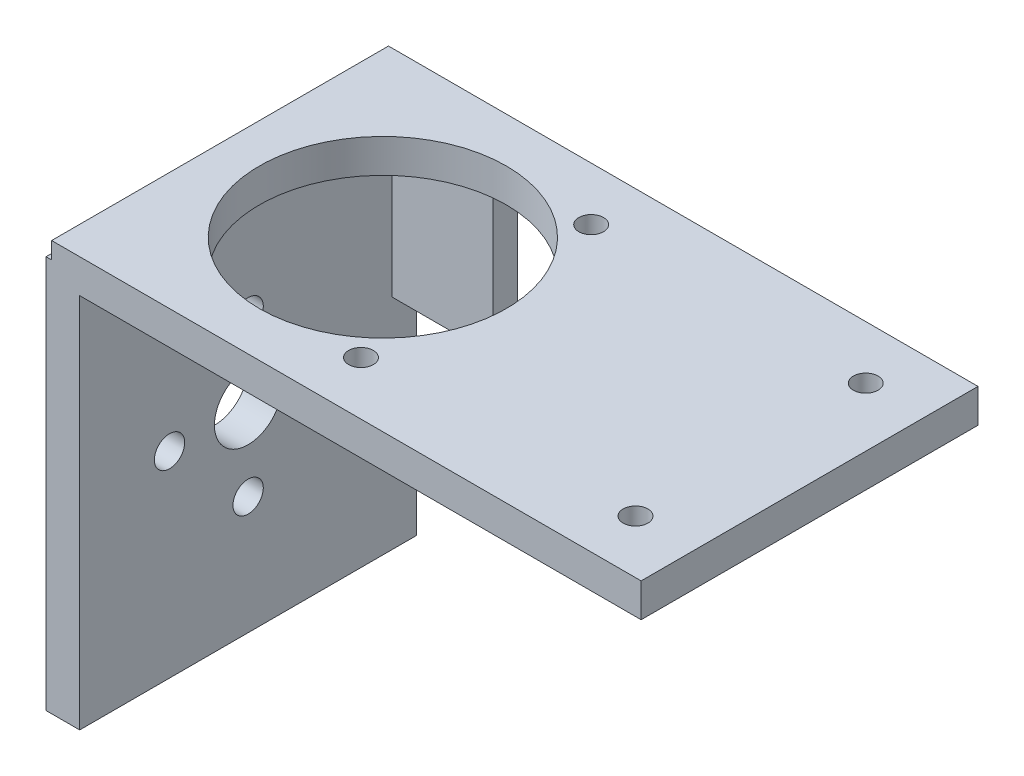
from build123d import *

# Parameters (mm, degrees)
S_BOX1_W      = 3
S_BOX1_H      = 35
BOSS_1_DEPTH  = 30
S_BOX2_W      = 52.5
S_BOX2_H      = 3
BOSS_2_DEPTH  = 30
S_BOX3_W      = 11.5
S_BOX3_H      = 16.5
BOSS_3_DEPTH  = 2.2
S_HOLE4_R     = 3
HOLE_4_DEPTH  = 3.2
S_HOLE5_R     = 1.35
HOLE_5_DEPTH  = 3.2
S_HOLE6_R     = 1.35
HOLE_6_DEPTH  = 3.2
S_HOLE7_R     = 1.35
HOLE_7_DEPTH  = 3.2
S_HOLE8_R     = 1.35
HOLE_8_DEPTH  = 3.2
S_HOLE9_R     = 11
HOLE_9_DEPTH  = 3.2
S_HOLE10_R    = 1.1
HOLE_10_DEPTH = 3.2
S_HOLE11_R    = 1.1
HOLE_11_DEPTH = 3.2
S_HOLE12_R    = 1.1
HOLE_12_DEPTH = 3.2
S_HOLE13_R    = 1.1
HOLE_13_DEPTH = 3.2


with BuildPart() as part:
    # S_box1 → Boss_1 (new body)
    with BuildSketch(Plane.XY.offset(-15)):
        with Locations((-13.5, 0)):
            Rectangle(S_BOX1_W, S_BOX1_H)
    extrude(amount=BOSS_1_DEPTH)

    # S_box2 → Boss_2 (add)
    with BuildSketch(Plane.XY.offset(-15)):
        with Locations((11.75, 17.5)):
            Rectangle(S_BOX2_W, S_BOX2_H)
    extrude(amount=BOSS_2_DEPTH)

    # S_box3 → Boss_3 (add)
    with BuildSketch(Plane.XY.offset(-15)):
        with Locations((-8.75, 10.25)):
            Rectangle(S_BOX3_W, S_BOX3_H)
    extrude(amount=BOSS_3_DEPTH)

    # S_hole4 → Hole_4 (cut)
    with BuildSketch(Plane(origin=(-15.1, 0, 0), x_dir=(0, 0, -1), z_dir=(1, 0, 0))):
        Circle(S_HOLE4_R)
    extrude(amount=HOLE_4_DEPTH, mode=Mode.SUBTRACT)

    # S_hole5 → Hole_5 (cut)
    with BuildSketch(Plane(origin=(-15.1, 0, 0), x_dir=(0, 0, -1), z_dir=(1, 0, 0))):
        with Locations((0, -7)):
            Circle(S_HOLE5_R)
    extrude(amount=HOLE_5_DEPTH, mode=Mode.SUBTRACT)

    # S_hole6 → Hole_6 (cut)
    with BuildSketch(Plane(origin=(-15.1, 0, 0), x_dir=(0, 0, -1), z_dir=(1, 0, 0))):
        with Locations((-7, 0)):
            Circle(S_HOLE6_R)
    extrude(amount=HOLE_6_DEPTH, mode=Mode.SUBTRACT)

    # S_hole7 → Hole_7 (cut)
    with BuildSketch(Plane(origin=(-15.1, 0, 0), x_dir=(0, 0, -1), z_dir=(1, 0, 0))):
        with Locations((0, 7)):
            Circle(S_HOLE7_R)
    extrude(amount=HOLE_7_DEPTH, mode=Mode.SUBTRACT)

    # S_hole8 → Hole_8 (cut)
    with BuildSketch(Plane(origin=(-15.1, 0, 0), x_dir=(0, 0, -1), z_dir=(1, 0, 0))):
        with Locations((7, 0)):
            Circle(S_HOLE8_R)
    extrude(amount=HOLE_8_DEPTH, mode=Mode.SUBTRACT)

    # S_hole9 → Hole_9 (cut)
    with BuildSketch(Plane(origin=(0, 15.9, 0), x_dir=(1, 0, 0), z_dir=(0, 1, 0))):
        Circle(S_HOLE9_R)
    extrude(amount=HOLE_9_DEPTH, mode=Mode.SUBTRACT)

    # S_hole10 → Hole_10 (cut)
    with BuildSketch(Plane(origin=(0, 15.9, 0), x_dir=(1, 0, 0), z_dir=(0, 1, 0))):
        with Locations((8.3, 10.25)):
            Circle(S_HOLE10_R)
    extrude(amount=HOLE_10_DEPTH, mode=Mode.SUBTRACT)

    # S_hole11 → Hole_11 (cut)
    with BuildSketch(Plane(origin=(0, 15.9, 0), x_dir=(1, 0, 0), z_dir=(0, 1, 0))):
        with Locations((8.3, -10.25)):
            Circle(S_HOLE11_R)
    extrude(amount=HOLE_11_DEPTH, mode=Mode.SUBTRACT)

    # S_hole12 → Hole_12 (cut)
    with BuildSketch(Plane(origin=(0, 15.9, 0), x_dir=(1, 0, 0), z_dir=(0, 1, 0))):
        with Locations((32.75, 10.25)):
            Circle(S_HOLE12_R)
    extrude(amount=HOLE_12_DEPTH, mode=Mode.SUBTRACT)

    # S_hole13 → Hole_13 (cut)
    with BuildSketch(Plane(origin=(0, 15.9, 0), x_dir=(1, 0, 0), z_dir=(0, 1, 0))):
        with Locations((32.75, -10.25)):
            Circle(S_HOLE13_R)
    extrude(amount=HOLE_13_DEPTH, mode=Mode.SUBTRACT)


solid = part.part
